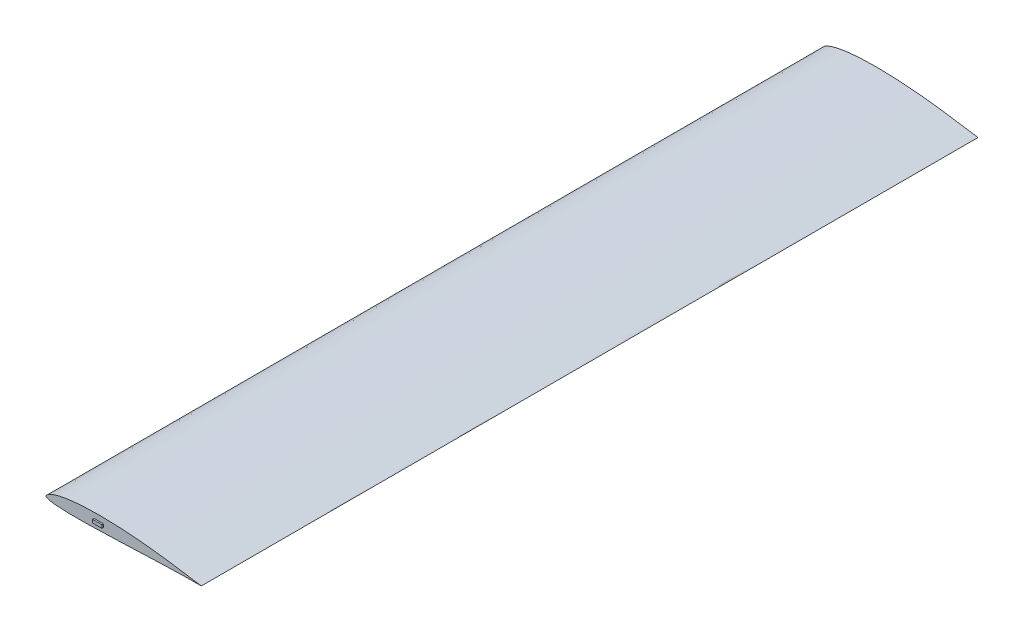
from build123d import *

# Parameters (mm, degrees)
BOSS_EXTRUDE1_DEPTH = 250
SKETCH2_W           = 3
SKETCH2_H           = 1
BOSS_EXTRUDE2_DEPTH = 0.5


with BuildPart() as part:
    # Sketch1 → Boss-Extrude1 (new body)
    with BuildSketch(Plane.XY):
        with BuildLine():
            add(Edge.make_bspline(
                [(50, 0), (50.000127321, 0.002422792), (49.652184009, 0.032958621), (49.301097208, 0.083188509), (48.459274004, 0.194453497), (47.441479646, 0.349875411), (46.133776608, 0.554864154), (44.615485046, 0.799310742), (42.892312753, 1.07508556), (40.995754148, 1.370980431), (38.94771753, 1.674669482), (36.770322955, 1.971115616), (34.483839246, 2.249761345), (32.108990986, 2.504840128), (29.66860858, 2.732239843), (27.188921164, 2.931782342), (24.697141476, 3.099622867), (22.218817139, 3.225155168), (19.778447637, 3.304800695), (17.399570259, 3.338767304), (15.104318179, 3.320960878), (12.913773107, 3.249229887), (10.847546414, 3.129619148), (8.924509706, 2.959577327), (7.161287843, 2.740428866), (5.571517506, 2.476714534), (4.16707883, 2.17390075), (2.957626952, 1.83762559), (1.950465142, 1.477263452), (1.148816473, 1.103045788), (0.558729346, 0.731078994), (0.228075961, 0.436603357), (0.089992171, 0.239435058), (0.040814575, 0.152213957), (0.010449843, 0.073827097), (-0.001543212, 0.012029906), (0.000871812, -0.036665913), (0.024720092, -0.080378542), (0.069417909, -0.130458815), (0.141050471, -0.188547481), (0.314418628, -0.296228741), (0.700511343, -0.453609623), (1.378093814, -0.628171654), (2.337457247, -0.787734756), (3.538967448, -0.918209355), (4.974167945, -1.015410816), (6.631209203, -1.07934352), (8.495610444, -1.110654464), (10.549669024, -1.111991231), (12.77276295, -1.086785548), (15.141440561, -1.038931402), (17.629849017, -0.972256842), (20.210338001, -0.890564709), (22.853820047, -0.797649566), (25.530288492, -0.69692322), (28.20906111, -0.592479053), (30.859040964, -0.487645246), (33.448999851, -0.386619732), (35.947841946, -0.292376734), (38.325016638, -0.208048773), (40.551004266, -0.135849855), (42.596395244, -0.078478019), (44.436055182, -0.036461301), (46.037752375, -0.009148581), (47.398981695, 0.004310281), (48.444054367, 0.00956179), (49.297247507, 0.004211274), (49.651501088, 0.008982102), (49.999872564, -0.00242498), (50, 0)],
                knots=[0, 0, 0, 0, 0.00163101, 0.006435235, 0.014220669, 0.024765625, 0.037826727, 0.053149348, 0.070473504, 0.089535694, 0.110075428, 0.131859875, 0.154692567, 0.178371256, 0.202679512, 0.227363961, 0.252132687, 0.276728351, 0.300939435, 0.324527111, 0.347267377, 0.368991726, 0.389507471, 0.40862838, 0.426224009, 0.442178728, 0.456395551, 0.468805124, 0.479372318, 0.488085518, 0.494967924, 0.50003381, 0.501035663, 0.50209449, 0.502996978, 0.50351288, 0.503955826, 0.504408894, 0.504955423, 0.505942626, 0.507129614, 0.510997735, 0.518231919, 0.527845532, 0.539808758, 0.554055915, 0.570489592, 0.588973674, 0.609342058, 0.631392897, 0.654894034, 0.679589725, 0.705203145, 0.731446604, 0.758020282, 0.784619628, 0.810935624, 0.836656653, 0.861473352, 0.885081475, 0.907187944, 0.927507338, 0.945765257, 0.961711874, 0.975121793, 0.985796266, 0.993581185, 0.998367518, 1, 1, 1, 1], degree=3))
        make_face()
    extrude(amount=BOSS_EXTRUDE1_DEPTH)

    # Sketch2 → Boss-Extrude2 (add)
    with BuildSketch(Plane.XY.offset(250)):
        with Locations((16.973, 1.049371014)):
            Rectangle(SKETCH2_W, SKETCH2_H)
    extrude(amount=BOSS_EXTRUDE2_DEPTH)


solid = part.part
